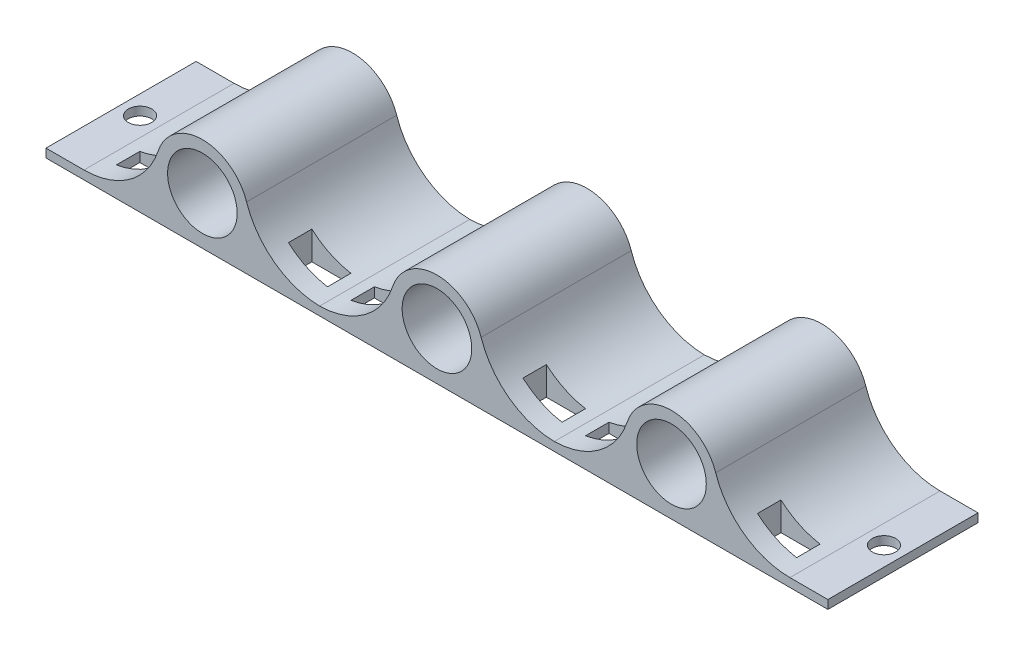
from build123d import *

# Parameters (mm, degrees)
ESQUISSE1_R                  = 5.95
ESQUISSE1_R_2                = 4.45
EXTRU_MINCE1_DEPTH           = 19.2
EXTRU_MINCE1_2_DEPTH         = 19.2
EXTRU_MINCE1_3_DEPTH         = 19.2
ESQUISSE3_W                  = 20
ESQUISSE3_H                  = 19.2
ESQUISSE3_W_2                = 40
BOSS_EXTRU_1_DEPTH           = 1.1
CONG_1_R                     = 10
ENL_V_MAT_EXTRU_1_DEPTH      = 83.99724393
ENL_V_MAT_EXTRU_1_DEPTH_BACK = 83.99724393
ESQUISSE4_W                  = 5
ESQUISSE4_H                  = 3
ESQUISSE5_R                  = 1.5
ENL_V_MAT_EXTRU_4_DEPTH      = 83.99724393


with BuildPart() as part:
    # Esquisse1 → Extru.-Mince1 (new body)
    with BuildSketch(Plane.XY):
        Circle(ESQUISSE1_R)
        Circle(ESQUISSE1_R_2, mode=Mode.SUBTRACT)
    extrude(amount=EXTRU_MINCE1_DEPTH)



with BuildPart() as body_2:
    # Esquisse1 → Extru.-Mince1 2 (new body)
    with BuildSketch(Plane.XY):
        with Locations((30, 0)):
            Circle(ESQUISSE1_R)
        with Locations((30, 0)):
            Circle(ESQUISSE1_R_2, mode=Mode.SUBTRACT)
    extrude(amount=EXTRU_MINCE1_2_DEPTH)


with BuildPart() as body_3:
    # Esquisse1 → Extru.-Mince1 3 (new body)
    with BuildSketch(Plane.XY):
        with Locations((60, 0)):
            Circle(ESQUISSE1_R)
        with Locations((60, 0)):
            Circle(ESQUISSE1_R_2, mode=Mode.SUBTRACT)
    extrude(amount=EXTRU_MINCE1_3_DEPTH)


with BuildPart() as part_1:
    add(part.part)

    add(body_2.part)  # Boss.-Extru.1 merges body 2

    add(body_3.part)  # Boss.-Extru.1 merges body 3
    # Esquisse3 → Boss.-Extru.1 (add)
    with BuildSketch(Plane(origin=(0, -5, 0), x_dir=(1, 0, 0), z_dir=(0, 1, 0))):
        with Locations((-10, -9.6)):
            Rectangle(ESQUISSE3_W, ESQUISSE3_H)
        with Locations((10, -9.6)):
            Rectangle(ESQUISSE3_W, ESQUISSE3_H)
        with Locations((30, -9.6)):
            Rectangle(ESQUISSE3_W, ESQUISSE3_H)
        with Locations((60, -9.6)):
            Rectangle(ESQUISSE3_W_2, ESQUISSE3_H)
    extrude(amount=-BOSS_EXTRU_1_DEPTH)

    # Congé1
    # the kernel refuses this fillet: 10 mm, written as the material it adds along each edge
    with BuildSketch(Plane(origin=(-3.225290685, -5, 19.2), x_dir=(-0.33303824301553114, 0.9429133198174305, 0), z_dir=(0, 0, -1)), Plane(origin=(26.774709315, -5, 19.2), x_dir=(-0.33303824301553103, 0.9429133198174305, 0), z_dir=(0, 0, -1)), Plane(origin=(56.774709315, -5, 19.2), x_dir=(-0.3330382430155325, 0.9429133198174301, 0), z_dir=(0, 0, -1))) as cong_1_piece_1:
        with BuildLine():
            CenterArc((13.399198301, -7.90985002), CONG_1_R, 127.722343038, 71.730945551)
            Line((3.970065103, -11.24023245), (0, 0))
            ThreePointArc((0, 0), (3.640421456, -1.243639238), (7.280842913, 0))
        make_face()
    extrude(amount=19.2)
    with BuildSketch(Plane(origin=(3.225290685, -5, 19.2), x_dir=(0.33303824301553153, 0.9429133198174304, 0), z_dir=(0, 0, -1))) as cong_1_piece_2:
        with BuildLine():
            CenterArc((13.399198301, 7.90985002), CONG_1_R, 160.546711411, 71.730945551)
            Line((3.970065103, 11.24023245), (0, 0))
            ThreePointArc((0, 0), (3.640421456, 1.243639238), (7.280842913, 0))
        make_face()
    extrude(amount=19.2)
    with BuildSketch(Plane(origin=(33.225290685, -5, 19.2), x_dir=(1, 0, 0), z_dir=(0, 0, -1)), Plane(origin=(63.225290685, -5, 19.2), x_dir=(1, 0, 0), z_dir=(0, 0, -1))) as cong_1_piece_3:
        with BuildLine():
            CenterArc((11.920748402, -10), CONG_1_R, 90, 71.730945551)
            ThreePointArc((2.424799131, -6.865203762), (2.385043568, -3.018422454), (0, 0))
            Line((0, 0), (11.920748402, 0))
        make_face()
    extrude(amount=19.2)

    # Esquisse4 → Enlèv. mat.-Extru.1 (cut, two sides: drawn at the far end of the back side and taken through both)
    with BuildSketch(Plane(origin=(0, -5, 0), x_dir=(1, 0, 0), z_dir=(0, 1, 0)).offset(-ENL_V_MAT_EXTRU_1_DEPTH_BACK)):
        with Locations((-11, -15.2)):
            Rectangle(ESQUISSE4_W, ESQUISSE4_H)
        with Locations((11, -15.2)):
            Rectangle(ESQUISSE4_W, ESQUISSE4_H)
        with Locations((19, -15.2)):
            Rectangle(ESQUISSE4_W, ESQUISSE4_H)
        with Locations((41, -15.2)):
            Rectangle(ESQUISSE4_W, ESQUISSE4_H)
        with Locations((49, -15.2)):
            Rectangle(ESQUISSE4_W, ESQUISSE4_H)
        with Locations((71, -15.2)):
            Rectangle(ESQUISSE4_W, ESQUISSE4_H)
    extrude(amount=ENL_V_MAT_EXTRU_1_DEPTH + ENL_V_MAT_EXTRU_1_DEPTH_BACK, mode=Mode.SUBTRACT)

    # Esquisse5 → Enlèv. mat.-Extru.4 (cut, through all)
    with BuildSketch(Plane(origin=(0, -5, 0), x_dir=(1, 0, 0), z_dir=(0, 1, 0))):
        with BuildLine():
            ThreePointArc((79.073019543, -9.6), (78.494574401, -8.416472796), (77.205370686, -8.145753007))
            Line((77.205370686, -8.145753007), (77.940668401, -11.054246993))
            ThreePointArc((77.940668401, -11.054246993), (78.756546747, -10.521554858), (79.073019543, -9.6))
        make_face()
        with BuildLine():
            Line((77.940668401, -11.054246993), (77.205370686, -8.145753007))
            ThreePointArc((77.205370686, -8.145753007), (76.11877255, -9.967648858), (77.940668401, -11.054246993))
        make_face()
        with Locations(Location((-17.573019543, -9.6, 0), (0, 0, 270))):
            Circle(ESQUISSE5_R)
    extrude(amount=-ENL_V_MAT_EXTRU_4_DEPTH, mode=Mode.SUBTRACT)


solid = part_1.part
